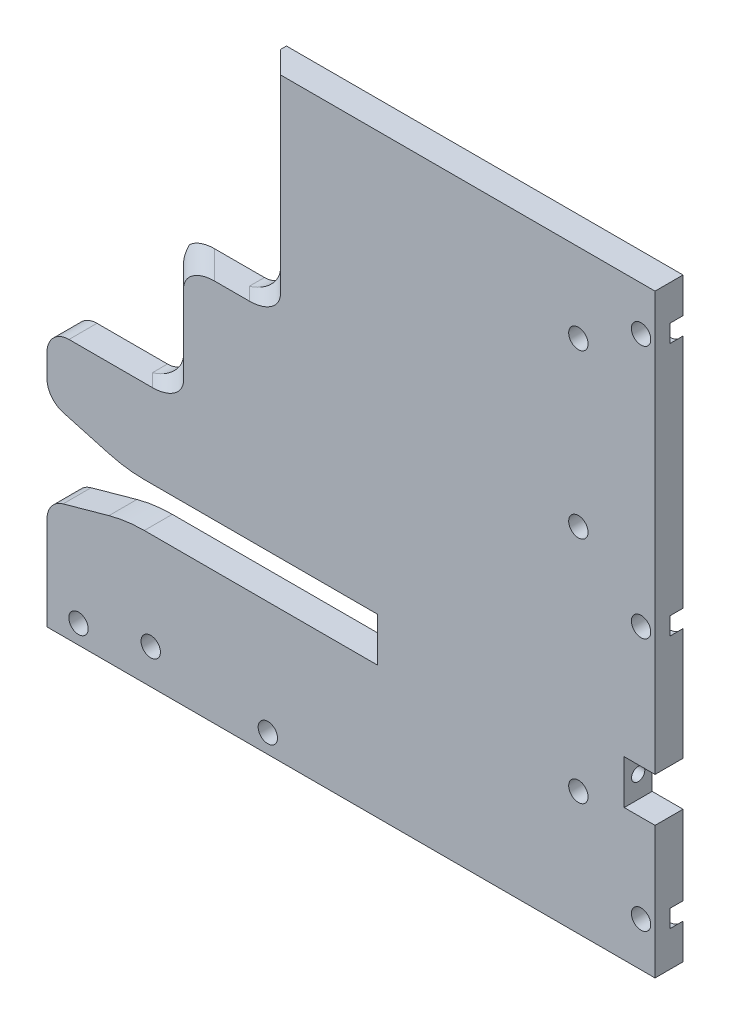
from build123d import *

# Parameters (mm, degrees)
BOSS_EXTRUDE1_DEPTH = 6.35
CUT_EXTRUDE1_DEPTH  = 194.156212688
SKETCH5_R           = 1.5
CUT_EXTRUDE2_DEPTH  = 155.564945897
FILLET1_R           = 30
CHAMFER1_SIZE       = 5
FILLET2_R           = 5
FILLET3_R           = 5
SKETCH6_W           = 7
SKETCH6_H           = 10
CUT_EXTRUDE3_DEPTH  = 194.156212688
HOLE1_D             = 4.4
HOLE1_CBORE_D       = 7.5
HOLE1_CBORE_DEPTH   = 3
HOLE2_D             = 4.4
HOLE2_CBORE_D       = 7.5
HOLE2_CBORE_DEPTH   = 3
FILLET4_R           = 5
HOLE3_D             = 4.4
HOLE3_CBORE_D       = 7.5
HOLE3_CBORE_DEPTH   = 3


with BuildPart() as part:
    # Sketch1 → Boss-Extrude1 (new body)
    with BuildSketch(Plane.XY):
        Polygon((0, 0), (-138, 0), (-138, 30), (-63, 30), (-63, 40), (-138, 40), (-138, 59), (-112, 59), (-112, 87), (-90, 87), (-90, 135), (0, 135), align=None)
    extrude(amount=BOSS_EXTRUDE1_DEPTH)

    # Sketch4 → Cut-Extrude1 (cut, through all)
    with BuildSketch(Plane(origin=(0, 0, 0), x_dir=(-1, 0, 0), z_dir=(0, 0, -1))):
        Polygon((120, 40), (138, 45), (138, 40), align=None)
        Polygon((120, 30), (138, 30), (138, 25), align=None)
    extrude(amount=-CUT_EXTRUDE1_DEPTH, mode=Mode.SUBTRACT)

    # Sketch5 → Cut-Extrude2 (cut, through all)
    with BuildSketch(Plane.ZY.offset(63)):
        with Locations((3.175, 35)):
            Circle(SKETCH5_R)
    extrude(amount=-CUT_EXTRUDE2_DEPTH, mode=Mode.SUBTRACT)

    # Fillet1
    fillet1_edges = [part.edges().sort_by_distance(p)[0] for p in [
        (-120, 40, 3.175),
        (-120, 30, 3.175),
    ]]
    fillet(fillet1_edges, radius=FILLET1_R)

    # Chamfer1
    chamfer1_edges = [part.edges().sort_by_distance(p)[0] for p in [
        (-112, 73, 6.35),
        (-90, 111, 6.35),
    ]]
    chamfer(chamfer1_edges, length=CHAMFER1_SIZE)

    # Fillet2
    fillet2_edges = [part.edges().sort_by_distance(p)[0] for p in [
        (-138, 25, 3.175),
        (-138, 45, 3.175),
        (-138, 59, 3.175),
    ]]
    fillet(fillet2_edges, radius=FILLET2_R)

    # Fillet3
    fillet3_edges = [part.edges().sort_by_distance(p)[0] for p in [
        (-87.5, 87, 3.85),
        (-90, 87, 0.675),
        (-109.5, 59, 3.85),
        (-112, 59, 0.675),
    ]]
    fillet(fillet3_edges, radius=FILLET3_R)

    # Sketch6 → Cut-Extrude3 (cut, through all)
    with BuildSketch(Plane(origin=(0, 0, 0), x_dir=(-1, 0, 0), z_dir=(0, 0, -1))):
        with Locations((3.5, 35)):
            Rectangle(SKETCH6_W, SKETCH6_H)
    extrude(amount=-CUT_EXTRUDE3_DEPTH, mode=Mode.SUBTRACT)

    # Hole1 (through all)
    with Locations(Plane(origin=(0, 0, 0), x_dir=(-1, 0, 0), z_dir=(0, 0, -1))):
        with Locations((3.175, 125), (3.175, 67.5), (3.175, 10)):
            CounterBoreHole(HOLE1_D / 2, HOLE1_CBORE_D / 2, HOLE1_CBORE_DEPTH)

    # Hole2 (through all)
    with Locations(Plane(origin=(0, 0, 0), x_dir=(-1, 0, 0), z_dir=(0, 0, -1))):
        with Locations((17.4, 117), (17.4, 80), (17.4, 28)):
            CounterBoreHole(HOLE2_D / 2, HOLE2_CBORE_D / 2, HOLE2_CBORE_DEPTH)

    # Fillet4
    fillet4_edges = [part.edges().sort_by_distance(p)[0] for p in [
        (-109.5, 87, 3.85),
    ]]
    fillet(fillet4_edges, radius=FILLET4_R)

    # Hole3 (through all)
    with Locations(Plane(origin=(0, 0, 0), x_dir=(-1, 0, 0), z_dir=(0, 0, -1))):
        with Locations((87.870353785, 4.293591352), (114.451398707, 7.906888356), (130.844995532, 4.293591352)):
            CounterBoreHole(HOLE3_D / 2, HOLE3_CBORE_D / 2, HOLE3_CBORE_DEPTH)


solid = part.part
